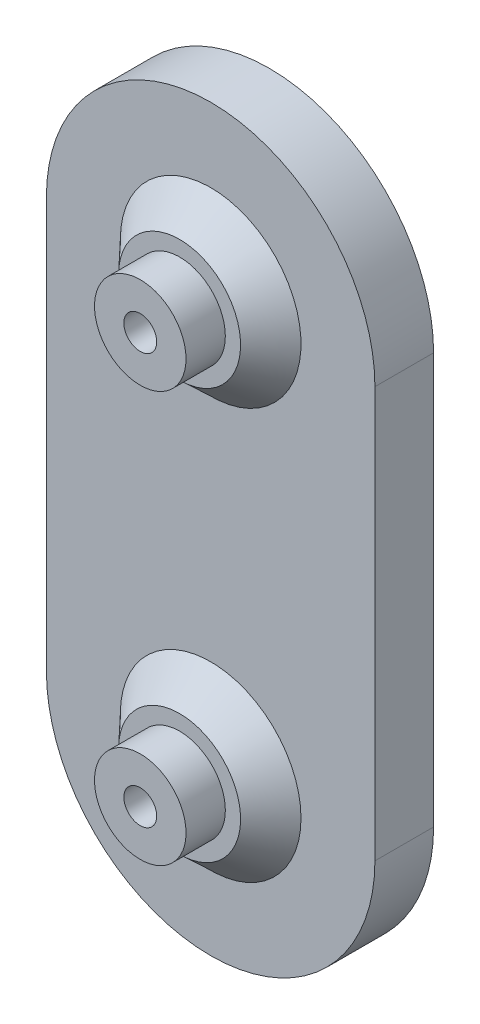
from build123d import *

# Parameters (mm, degrees)
SKETCH_1_R           = 3.9
SKETCH_1_R_2         = 1.4
EXTRUDE_1_DEPTH      = 3.35
SKETCH_2_R           = 5.2
SKETCH_3_R           = 7.7
EXTRUDE_2_DEPTH      = 5
MIRROR_START         = -3.35
MIRROR_6_OUTLINE_R   = 3.9
MIRROR_6_OUTLINE_R_2 = 1.4
MIRROR_6_DEPTH       = 3.35
SKETCH_1_3_R         = 1.4
CUT_EXTRUDE_1_DEPTH  = 11


# Read off the part's stored shape, not the designer's step: 镜向6
with BuildPart() as part:
    # 草图1 → 凸台-拉伸1 (new body)
    with BuildSketch(Plane.XY):
        Circle(SKETCH_1_R)
        Circle(SKETCH_1_R_2, mode=Mode.SUBTRACT)
    extrude(amount=-EXTRUDE_1_DEPTH)

    # 草图2 → 放样1 section 0
    with BuildSketch(Plane(origin=(0, 0, -3.35), x_dir=(-1, 0, 0), z_dir=(0, 0, -1))):
        Circle(SKETCH_2_R)
    # 草图3 → 放样1 section 1
    with BuildSketch(Plane(origin=(0, 0, -6), x_dir=(-1, 0, 0), z_dir=(0, 0, -1))):
        Circle(SKETCH_3_R)
    loft_1 = loft()

    # 草图5 → 凸台-拉伸2 (add)
    with BuildSketch(Plane(origin=(0, 0, -6), x_dir=(-1, 0, 0), z_dir=(0, 0, -1))):
        with BuildLine():
            Line((-14, 0), (-14, -35))
            ThreePointArc((-14, -35), (0, -49), (14, -35))
            Line((14, -35), (14, 0))
            ThreePointArc((14, 0), (0, 14), (-14, 0))
        make_face()
    extrude(amount=EXTRUDE_2_DEPTH)

    # 镜向5: 放样1 across plane
    add(loft_1.mirror(Plane(origin=(0, -17.5, 0), x_dir=(0, 0, 1), z_dir=(0, -1, 0))))

    # 镜向6 outline → 镜向6 (add)
    with BuildSketch(Plane.XY.offset(MIRROR_START)):
        with Locations((0, -35)):
            Circle(MIRROR_6_OUTLINE_R)
        with Locations((0, -35)):
            Circle(MIRROR_6_OUTLINE_R_2, mode=Mode.SUBTRACT)
    extrude(amount=MIRROR_6_DEPTH)

    # 草图1<3> → 切除-拉伸1 (cut)
    with BuildSketch(Plane.XY):
        Circle(SKETCH_1_3_R)
    cut_extrude_1 = extrude(amount=-CUT_EXTRUDE_1_DEPTH, mode=Mode.SUBTRACT)

    # 镜向7: 切除-拉伸1 across plane
    add(cut_extrude_1.mirror(Plane(origin=(0, -17.5, 0), x_dir=(0, 0, 1), z_dir=(0, -1, 0))), mode=Mode.SUBTRACT)


solid = part.part
